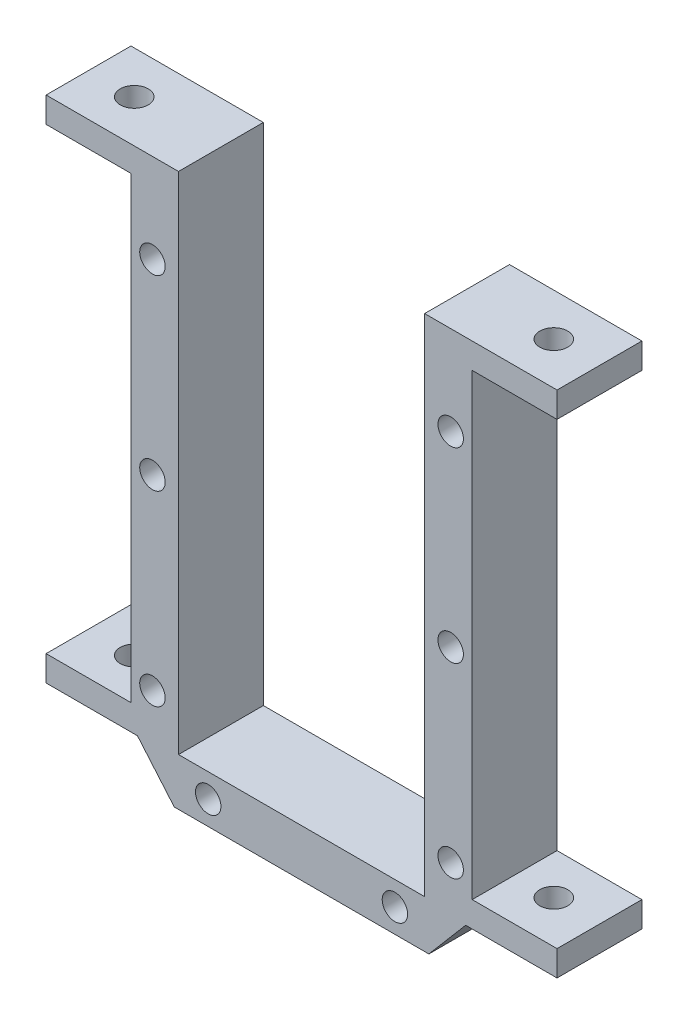
from build123d import *

# Parameters (mm, degrees)
SKETCH1_W           = 40.2
SKETCH1_H           = 65.1
BOSS_EXTRUDE1_DEPTH = 10
CUT_EXTRUDE1_DEPTH  = 10
SKETCH4_W           = 29
SKETCH4_H           = 59.5
CUT_EXTRUDE2_DEPTH  = 10
SKETCH5_R           = 1.5
CUT_EXTRUDE3_DEPTH  = 10
SKETCH7_W           = 10
SKETCH7_H           = 3
BOSS_EXTRUDE2_DEPTH = 10
SKETCH8_W           = 10
SKETCH8_H           = 3
BOSS_EXTRUDE3_DEPTH = 10
SKETCH9_R           = 1.65
CUT_EXTRUDE4_DEPTH  = 68.867591677
SKETCH10_R          = 1.65
CUT_EXTRUDE5_DEPTH  = 68.867591677


with BuildPart() as part:
    # Sketch1 → Boss-Extrude1 (new body)
    with BuildSketch(Plane.XY):
        Rectangle(SKETCH1_W, SKETCH1_H)
    extrude(amount=BOSS_EXTRUDE1_DEPTH)

    # Sketch2 → Cut-Extrude1 (cut)
    with BuildSketch(Plane.XY.offset(10)):
        Polygon((15, -32.55), (19.335, -27.45), (20.1, -27.45), (20.1, -32.55), align=None)
        Polygon((-20.1, -27.45), (-20.1, -32.55), (-15, -32.55), (-19.335, -27.45), align=None)
    extrude(amount=-CUT_EXTRUDE1_DEPTH, mode=Mode.SUBTRACT)

    # Sketch4 → Cut-Extrude2 (cut)
    with BuildSketch(Plane.XY.offset(10)):
        with Locations((0, 2.8)):
            Rectangle(SKETCH4_W, SKETCH4_H)
    extrude(amount=-CUT_EXTRUDE2_DEPTH, mode=Mode.SUBTRACT)

    # Sketch5 → Cut-Extrude3 (cut)
    with BuildSketch(Plane.XY.offset(10)):
        with Locations((-17.569605829, 22.05)):
            Circle(SKETCH5_R)
        with Locations((-17.569605829, 0.05)):
            Circle(SKETCH5_R)
        with Locations((-17.569605829, -21.95)):
            Circle(SKETCH5_R)
        with Locations((-11, -29.75)):
            Circle(SKETCH5_R)
        with Locations((11, -29.75)):
            Circle(SKETCH5_R)
        with Locations((17.569605829, -21.95)):
            Circle(SKETCH5_R)
        with Locations((17.569605829, 0.05)):
            Circle(SKETCH5_R)
        with Locations((17.569605829, 22.05)):
            Circle(SKETCH5_R)
    extrude(amount=-CUT_EXTRUDE3_DEPTH, mode=Mode.SUBTRACT)

    # Sketch7 → Boss-Extrude2 (add)
    with BuildSketch(Plane(origin=(20.1, 0, 0), x_dir=(0, 0, -1), z_dir=(1, 0, 0))):
        with Locations((-5, 31.05)):
            Rectangle(SKETCH7_W, SKETCH7_H)
        with Locations((-5, -25.95)):
            Rectangle(SKETCH7_W, SKETCH7_H)
    extrude(amount=BOSS_EXTRUDE2_DEPTH)

    # Sketch8 → Boss-Extrude3 (add)
    with BuildSketch(Plane.ZY.offset(20.1)):
        with Locations((5, 31.05)):
            Rectangle(SKETCH8_W, SKETCH8_H)
        with Locations((5, -25.95)):
            Rectangle(SKETCH8_W, SKETCH8_H)
    extrude(amount=BOSS_EXTRUDE3_DEPTH)

    # Sketch9 → Cut-Extrude4 (cut, through all)
    with BuildSketch(Plane(origin=(0, -27.45, 0), x_dir=(-1, 0, 0), z_dir=(0, -1, 0))):
        with Locations((24.7175, -5)):
            Circle(SKETCH9_R)
    extrude(amount=-CUT_EXTRUDE4_DEPTH, mode=Mode.SUBTRACT)

    # Sketch10 → Cut-Extrude5 (cut, through all)
    with BuildSketch(Plane(origin=(0, -27.45, 0), x_dir=(-1, 0, 0), z_dir=(0, -1, 0))):
        with Locations((-24.7175, -5)):
            Circle(SKETCH10_R)
    extrude(amount=-CUT_EXTRUDE5_DEPTH, mode=Mode.SUBTRACT)


solid = part.part
